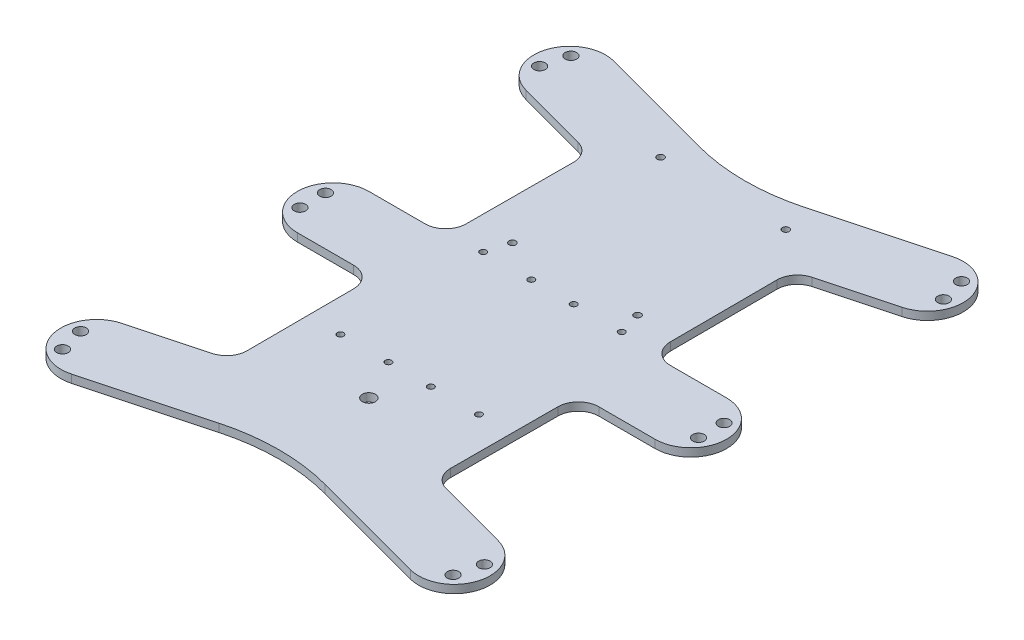
from build123d import *

# Parameters (mm, degrees)
BOSS_EXTRUDE1_DEPTH = 3.175
FILLET1_R           = 80
FILLET2_R           = 8
SKETCH2_R           = 1.35
CUT_EXTRUDE1_DEPTH  = 136.741386774
SKETCH3_R           = 1.25
CUT_EXTRUDE2_DEPTH  = 136.741386774
SKETCH5_R           = 2.55
CUT_EXTRUDE3_DEPTH  = 136.741386774
SKETCH7_R           = 2.25
CUT_EXTRUDE4_DEPTH  = 10


with BuildPart() as part:
    # Sketch1 → Boss-Extrude1 (new body)
    with BuildSketch(Plane(origin=(0, 0, 0), x_dir=(1, 0, 0), z_dir=(0, 1, 0))):
        with BuildLine():
            Line((-70, 14), (-40, 14))
            Line((-40, 14), (-39.816062711, 70))
            Line((-39.816062711, 70), (-73.623466631, 79.058666579))
            ThreePointArc((-73.623466631, 79.058666579), (-83.522961568, 96.205094778), (-66.376533369, 106.104589715))
            Line((-66.376533369, 106.104589715), (0, 88.319051202))
            Line((0, 88.319051202), (66.376533369, 106.104589715))
            ThreePointArc((66.376533369, 106.104589715), (83.522961568, 96.205094778), (73.623466631, 79.058666579))
            Line((73.623466631, 79.058666579), (39.816062711, 70))
            Line((39.816062711, 70), (40, 14))
            Line((40, 14), (70, 14))
            ThreePointArc((70, 14), (84, 0), (70, -14))
            Line((70, -14), (40, -14))
            Line((40, -14), (39.816062711, -70))
            Line((39.816062711, -70), (73.623466631, -79.058666579))
            ThreePointArc((73.623466631, -79.058666579), (83.522961568, -96.205094778), (66.376533369, -106.104589715))
            Line((66.376533369, -106.104589715), (0, -88.319051202))
            Line((0, -88.319051202), (-66.376533369, -106.104589715))
            ThreePointArc((-66.376533369, -106.104589715), (-83.522961568, -96.205094778), (-73.623466631, -79.058666579))
            Line((-73.623466631, -79.058666579), (-39.816062711, -70))
            Line((-39.816062711, -70), (-40, -14))
            Line((-40, -14), (-70, -14))
            ThreePointArc((-70, -14), (-84, 0), (-70, 14))
        make_face()
    extrude(amount=BOSS_EXTRUDE1_DEPTH)

    # Fillet1
    fillet1_edges = [part.edges().sort_by_distance(p)[0] for p in [
        (0, 1.5875, -88.319051202),
        (0, 1.5875, 88.319051202),
    ]]
    fillet(fillet1_edges, radius=FILLET1_R)

    # Fillet2
    fillet2_edges = [part.edges().sort_by_distance(p)[0] for p in [
        (39.816062711, 1.5875, 70),
        (40, 1.5875, 14),
        (40, 1.5875, -14),
        (39.816062711, 1.5875, -70),
        (-39.816062711, 1.5875, -70),
        (-40, 1.5875, -14),
        (-40, 1.5875, 14),
        (-39.816062711, 1.5875, 70),
    ]]
    fillet(fillet2_edges, radius=FILLET2_R)

    # Sketch2 → Cut-Extrude1 (cut, through all)
    with BuildSketch(Plane(origin=(0, 3.175, 0), x_dir=(1, 0, 0), z_dir=(0, 1, 0))):
        with Locations((-24.5, 24.641145635)):
            Circle(SKETCH2_R)
        with Locations((24.5, 24.641145635)):
            Circle(SKETCH2_R)
        with Locations((24.5, 82.641145635)):
            Circle(SKETCH2_R)
        with Locations((-24.5, 82.641145635)):
            Circle(SKETCH2_R)
    extrude(amount=-CUT_EXTRUDE1_DEPTH, mode=Mode.SUBTRACT)

    # Sketch3 → Cut-Extrude2 (cut, through all)
    with BuildSketch(Plane(origin=(0, 3.175, 0), x_dir=(1, 0, 0), z_dir=(0, 1, 0))):
        with Locations((-8.3, -40.058854365)):
            Circle(SKETCH3_R)
        with Locations((-27.1, -40.058854365)):
            Circle(SKETCH3_R)
        with Locations((-27.1, 15.841145635)):
            Circle(SKETCH3_R)
        with Locations((-8.3, 15.841145635)):
            Circle(SKETCH3_R)
        with Locations((8.3, 15.841145635)):
            Circle(SKETCH3_R)
        with Locations((27.1, 15.841145635)):
            Circle(SKETCH3_R)
        with Locations((8.3, -40.058854365)):
            Circle(SKETCH3_R)
        with Locations((27.1, -40.058854365)):
            Circle(SKETCH3_R)
    extrude(amount=-CUT_EXTRUDE2_DEPTH, mode=Mode.SUBTRACT)

    # Sketch5 → Cut-Extrude3 (cut, through all)
    with BuildSketch(Plane(origin=(0, 3.175, 0), x_dir=(1, 0, 0), z_dir=(0, 1, 0))):
        with Locations((0, -56.018854365)):
            Circle(SKETCH5_R)
    extrude(amount=-CUT_EXTRUDE3_DEPTH, mode=Mode.SUBTRACT)

    # Sketch7 → Cut-Extrude4 (cut)
    with BuildSketch(Plane(origin=(0, 3.175, 0), x_dir=(1, 0, 0), z_dir=(0, 1, 0))):
        with Locations((-76.433311385, -99.481809639)):
            Circle(SKETCH7_R)
        with Locations((-79.021501836, -89.822551376)):
            Circle(SKETCH7_R)
        with Locations((-78, -5)):
            Circle(SKETCH7_R)
        with Locations((-78, 5)):
            Circle(SKETCH7_R)
        with Locations((-79.021501836, 89.822551376)):
            Circle(SKETCH7_R)
        with Locations((-76.433311385, 99.481809639)):
            Circle(SKETCH7_R)
        with Locations((79.021501836, 89.822551376)):
            Circle(SKETCH7_R)
        with Locations((76.433311385, 99.481809639)):
            Circle(SKETCH7_R)
        with Locations((78, -5)):
            Circle(SKETCH7_R)
        with Locations((78, 5)):
            Circle(SKETCH7_R)
        with Locations((79.021501836, -89.822551376)):
            Circle(SKETCH7_R)
        with Locations((76.433311385, -99.481809639)):
            Circle(SKETCH7_R)
    extrude(amount=-CUT_EXTRUDE4_DEPTH, mode=Mode.SUBTRACT)


solid = part.part
